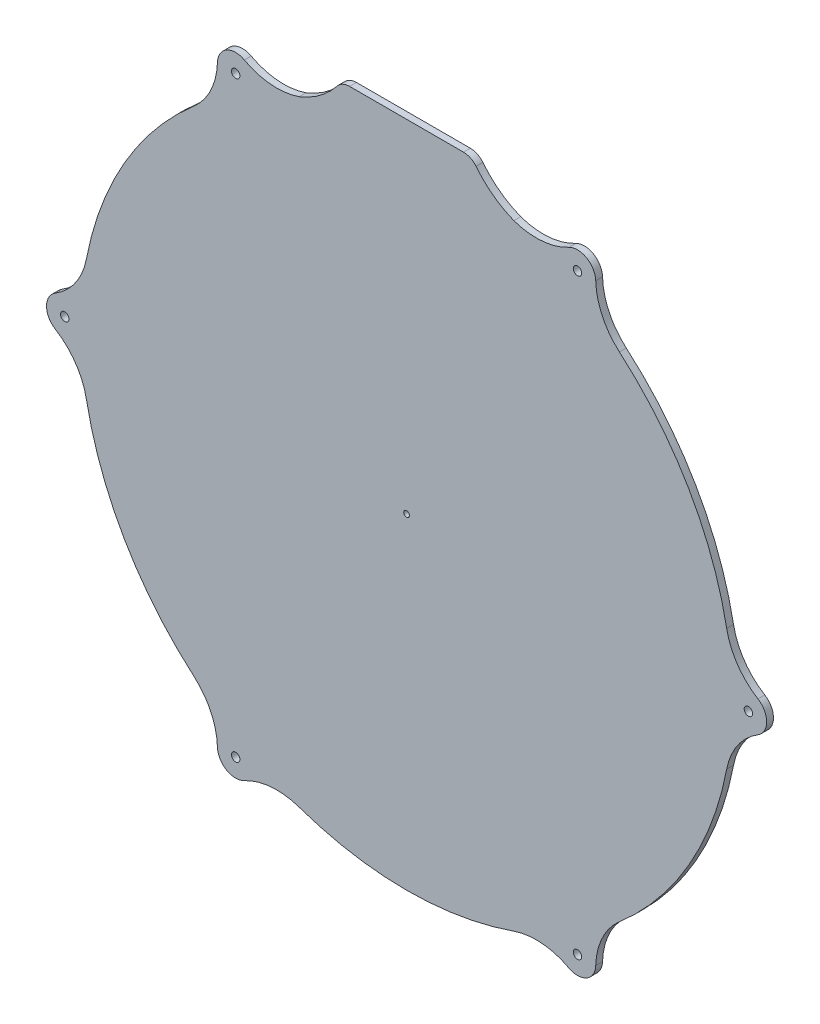
from build123d import *

# Parameters (mm, degrees)
SKETCH1_R                = 143
SKETCH1_R_2              = 1.25
BOSS_EXTRUDE1_DEPTH      = 3
SKETCH2_R                = 1.85
BOSS_EXTRUDE2_DEPTH      = 3
FILLET1_R                = 30
CIRPATTERN1_COUNT        = 6
FILLET1_OF_CIRPATTERN1_R = 30
BOSS_EXTRUDE4_DEPTH      = 3
FILLET2_R                = 40


with BuildPart() as part:
    # Sketch1 → Boss-Extrude1 (new body)
    with BuildSketch(Plane.XY):
        Circle(SKETCH1_R)
        Circle(SKETCH1_R_2, mode=Mode.SUBTRACT)
    extrude(amount=BOSS_EXTRUDE1_DEPTH)

    # Sketch2 → Boss-Extrude2 (add)
    with BuildSketch(Plane.XY.offset(3)):
        with BuildLine():
            Line((-136, -8), (-150, -8))
            ThreePointArc((-150, -8), (-158, 0), (-150, 8))
            Line((-150, 8), (-136, 8))
            ThreePointArc((-136, 8), (-128, 0), (-136, -8))
        make_face()
        with Locations((-150, 0)):
            Circle(SKETCH2_R, mode=Mode.SUBTRACT)
    boss_extrude2 = extrude(amount=-BOSS_EXTRUDE2_DEPTH)

    # Fillet1
    fillet1_edges = [part.edges().sort_by_distance(p)[0] for p in [
        (-142.776048411, 8, 1.5),
        (-142.776048411, -8, 1.5),
    ]]
    fillet(fillet1_edges, radius=FILLET1_R)

    # CirPattern1: Boss-Extrude2 ×6 about axis
    cirpattern1_axis = Axis((0, 0, 0), (0, 0, 1))
    for i in range(1, CIRPATTERN1_COUNT):
        add(boss_extrude2.rotate(cirpattern1_axis, i * 360 / CIRPATTERN1_COUNT))

    # Fillet1 of CirPattern1
    fillet1_of_cirpattern1_edges = [part.edges().sort_by_distance(p)[0] for p in [
        (-78.316227436, -119.647684976, 1.5),
        (-64.459820975, -127.647684976, 1.5),
        (64.459820975, -127.647684976, 1.5),
        (78.316227436, -119.647684976, 1.5),
        (142.776048411, -8, 1.5),
        (142.776048411, 8, 1.5),
        (78.316227436, 119.647684976, 1.5),
        (64.459820975, 127.647684976, 1.5),
        (-64.459820975, 127.647684976, 1.5),
        (-78.316227436, 119.647684976, 1.5),
    ]]
    fillet(fillet1_of_cirpattern1_edges, radius=FILLET1_OF_CIRPATTERN1_R)

    # Sketch6 → Boss-Extrude4 (add)
    with BuildSketch(Plane.XY.offset(3)):
        with BuildLine():
            Line((-25, 150), (25, 150))
            ThreePointArc((25, 150), (32, 143), (25, 136))
            Line((25, 136), (-25, 136))
            ThreePointArc((-25, 136), (-32, 143), (-25, 150))
        make_face()
    extrude(amount=-BOSS_EXTRUDE4_DEPTH)

    # Fillet2
    # the kernel refuses this fillet: 40 mm, written as the material it adds along each edge
    with BuildSketch(Plane(origin=(31.105412767, 139.575976789, 3), x_dir=(0.9617682057549536, -0.27386478123135344, 0), z_dir=(0, 0, -1))) as fillet2_piece_1:
        with BuildLine():
            CenterArc((20.599589027, -39.801292998), FILLET2_R, 95.71339394, 29.960885515)
            ThreePointArc((-2.727475038, -7.307476939), (-0.251629619, -4.068826545), (0, 0))
            ThreePointArc((0, 0), (8.308747323, -0.241586175), (16.617494645, 0))
        make_face()
    extrude(amount=3)
    with BuildSketch(Plane(origin=(-31.105412767, 139.575976789, 3), x_dir=(-0.9617682057549533, -0.27386478123135494, 0), z_dir=(0, 0, -1))) as fillet2_piece_2:
        with BuildLine():
            CenterArc((20.599589027, 39.801292998), FILLET2_R, 234.325720545, 29.960885515)
            ThreePointArc((-2.727475038, 7.307476939), (-0.251629619, 4.068826545), (0, 0))
            ThreePointArc((0, 0), (8.308747323, 0.241586175), (16.617494645, 0))
        make_face()
    extrude(amount=3)


solid = part.part
